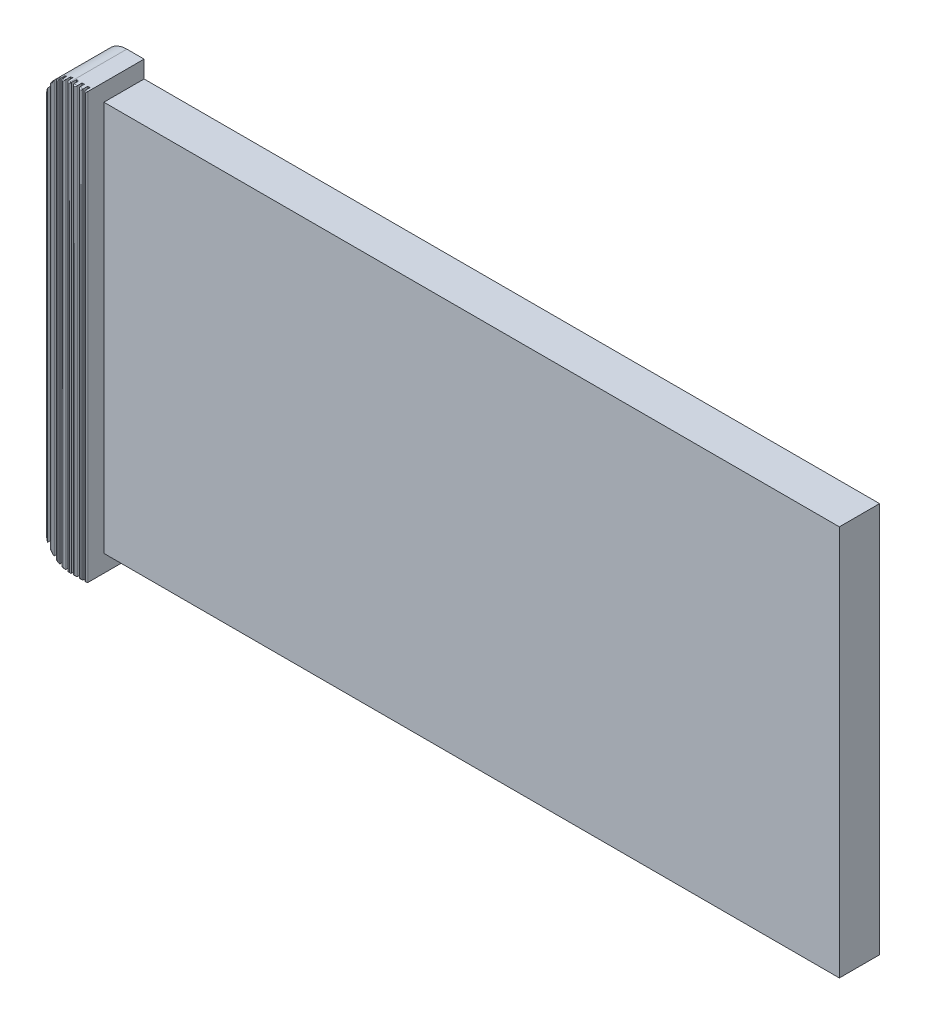
from build123d import *

# Parameters (mm, degrees)
CROQUIS1_W              = 64
CROQUIS1_H              = 34
SALIENTE_EXTRUIR1_DEPTH = 3.5
CROQUIS3_W              = 5
CROQUIS3_H              = 37
SALIENTE_EXTRUIR2_DEPTH = 3.5
REDONDEO1_R             = 2
CROQUIS4_W              = 0.2
CROQUIS4_H              = 37
CORTAR_EXTRUIR1_DEPTH   = 0.5
REDONDEO2_R             = 0.1


with BuildPart() as part:
    # Croquis1 → Saliente-Extruir1 (new body)
    with BuildSketch(Plane.XY):
        Rectangle(CROQUIS1_W, CROQUIS1_H)
    extrude(amount=SALIENTE_EXTRUIR1_DEPTH)

    # Croquis3 → Saliente-Extruir2 (add)
    with BuildSketch(Plane.ZY.offset(32)):
        with Locations((2.5, 0)):
            Rectangle(CROQUIS3_W, CROQUIS3_H)
    extrude(amount=SALIENTE_EXTRUIR2_DEPTH)

    # Redondeo1
    redondeo1_edges = [part.edges().sort_by_distance(p)[0] for p in [
        (-35.5, 18.5, 2.5),
        (-35.5, -18.5, 2.5),
    ]]
    fillet(redondeo1_edges, radius=REDONDEO1_R)

    # Croquis4 → Cortar-Extruir1 (cut)
    with BuildSketch(Plane.XY.offset(5)):
        with Locations((-32.3, 0)):
            Rectangle(CROQUIS4_W, CROQUIS4_H)
        with Locations((-32.8, 0)):
            Rectangle(CROQUIS4_W, CROQUIS4_H)
        with Locations((-33.3, 0)):
            Rectangle(CROQUIS4_W, CROQUIS4_H)
        with Locations((-33.8, 0)):
            Rectangle(CROQUIS4_W, CROQUIS4_H)
        with Locations((-34.3, 0)):
            Rectangle(CROQUIS4_W, CROQUIS4_H)
        with Locations((-34.8, 0)):
            Rectangle(CROQUIS4_W, CROQUIS4_H)
        with Locations((-35.3, 0)):
            Rectangle(CROQUIS4_W, CROQUIS4_H)
    extrude(amount=-CORTAR_EXTRUIR1_DEPTH, mode=Mode.SUBTRACT)

    # Redondeo2
    redondeo2_edges = [part.edges().sort_by_distance(p)[0] for p in [
        (-32.9, 0, 5),
        (-32.7, 0, 5),
        (-33.4, 0, 5),
        (-33.2, 0, 5),
        (-33.7, 0, 5),
        (-33.9, 0, 5),
        (-34.2, 0, 5),
        (-34.4, 0, 5),
        (-34.7, 0, 5),
        (-34.9, 0, 5),
        (-35.2, 0, 5),
        (-32, 0, 5),
        (-33.45, 18.5, 5),
        (-33.45, -18.5, 5),
        (-33.60012555, 18.497492146, 5),
        (-34.051681951, 18.422406571, 5),
        (-34.554113045, 18.199660463, 5),
        (-35.061282751, 17.749958468, 5),
        (-35.061282751, -17.749958468, 5),
        (-34.554113045, -18.199660463, 5),
        (-34.051681951, -18.422406571, 5),
        (-33.60012555, -18.497492146, 5),
        (-33.05, -18.5, 5),
        (-32.55, -18.5, 5),
        (-32.1, -18.5, 5),
        (-33.05, 18.5, 5),
        (-32.55, 18.5, 5),
        (-32.1, 18.5, 5),
        (-32.4, 0, 5),
        (-32.2, 0, 5),
    ]]
    fillet(redondeo2_edges, radius=REDONDEO2_R - 0.0001)  # a hair under: the kernel refuses the full size


solid = part.part
